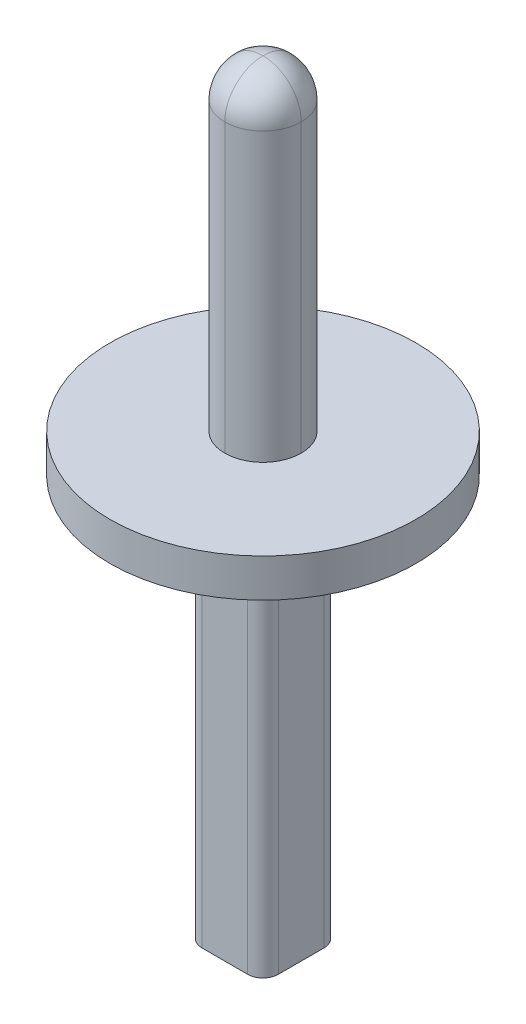
from build123d import *

# Parameters (mm, degrees)
SKETCH1_W           = 10
SKETCH1_H           = 10
BOSS_EXTRUDE1_DEPTH = 50
BOSS_EXTRUDE2_START = -45
SKETCH2_R           = 20
BOSS_EXTRUDE2_DEPTH = 2.5
FILLET2_R           = 2
FILLET3_R           = 5
FILLET4_R           = 5
SCALE1_SCALE        = 1.5


with BuildPart() as part:
    # Sketch1 → Boss-Extrude1 (new, symmetric)
    with BuildSketch(Plane(origin=(0, 0, 0), x_dir=(1, 0, 0), z_dir=(0, 1, 0))):
        Rectangle(SKETCH1_W, SKETCH1_H)
    extrude(amount=BOSS_EXTRUDE1_DEPTH, both=True)

    # Sketch2 → Boss-Extrude2 (add, symmetric)
    with BuildSketch(Plane(origin=(0, 50, 0), x_dir=(1, 0, 0), z_dir=(0, 1, 0)).offset(BOSS_EXTRUDE2_START)):
        with Locations(Location((0, 0, 0), (0, 0, 270))):
            Circle(SKETCH2_R)
    extrude(amount=BOSS_EXTRUDE2_DEPTH, both=True)

    # Fillet2
    fillet2_edges = [part.edges().sort_by_distance(p)[0] for p in [
        (5, -23.75, 5),
        (-5, -23.75, 5),
        (-5, -23.75, -5),
        (5, -23.75, -5),
    ]]
    fillet(fillet2_edges, radius=FILLET2_R)

    # Fillet3
    fillet3_edges = [part.edges().sort_by_distance(p)[0] for p in [
        (-5, 28.75, -5),
        (-5, 28.75, 5),
        (5, 28.75, 5),
        (5, 28.75, -5),
    ]]
    fillet(fillet3_edges, radius=FILLET3_R - 0.0001)  # a hair under: the kernel refuses the full size

    # Fillet4
    fillet4_edges = [part.edges().sort_by_distance(p)[0] for p in [
        (3.535563195, 50, -3.535563195),
        (3.535563195, 50, 3.535563195),
        (-3.535563195, 50, 3.535563195),
        (-3.535563195, 50, -3.535563195),
    ]]
    fillet(fillet4_edges, radius=FILLET4_R - 0.0001)  # a hair under: the kernel refuses the full size


with BuildPart() as part_1:
    # Scale1: scaled about (0, 0.040894901, 0)
    add(part.part.scale(SCALE1_SCALE).moved(Location((0, -0.02044745, 0))))


solid = part_1.part
